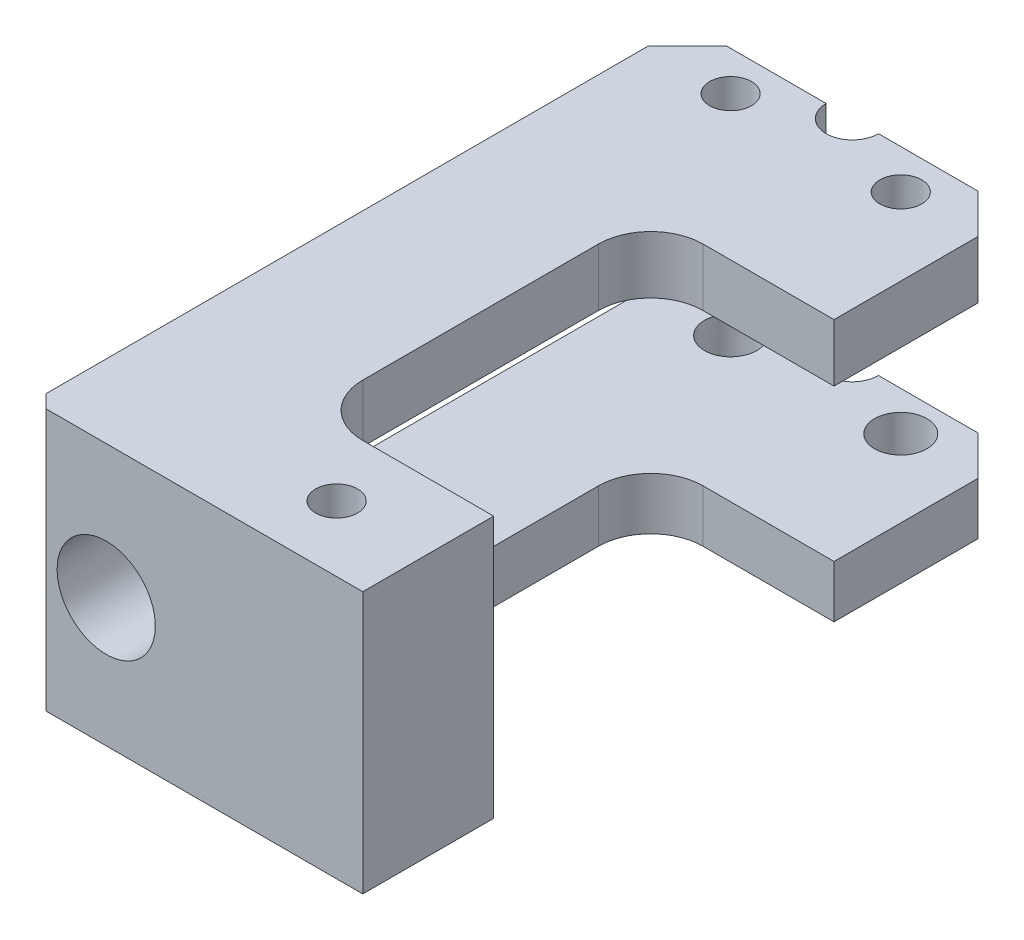
from build123d import *

# Parameters (mm, degrees)
SKETCH1_W                   = 12.6
SKETCH1_H                   = 25
BOSS_EXTRUDE1_DEPTH         = 10
CHAMFER4_SIZE               = 1.5
CUT_EXTRUDE9_START          = -5
SKETCH14_W                  = 7
SKETCH14_H                  = 5.8
CUT_EXTRUDE9_DEPTH          = 20
SKETCH15_W                  = 20
SKETCH15_H                  = 5.8
CUT_EXTRUDE10_DEPTH         = 18.47140521
CUT_EXTRUDE11_DEPTH         = 17.122654868
CUT_EXTRUDE11_DEPTH_BACK    = 17.122654868
SKETCH17_W                  = 7
SKETCH17_H                  = 13
SKETCH18_R                  = 1.875
CUT_EXTRUDE12_DEPTH         = 24.231228982
FILLET2_R                   = 2
SKETCH20_R                  = 1
CUT_EXTRUDE18_DEPTH         = 5
TAP_DRILL_FOR_M2X0_4_TAP2_D = 1.6
TAP_DRILL_FOR_M2X0_4_TAP3_D = 1.6
FILLET4_R                   = 0.2
CHAMFER1_SIZE               = 0.5
SKETCH26_R                  = 1.5
CUT_EXTRUDE20_DEPTH         = 1
SKETCH28_R                  = 1
CUT_EXTRUDE22_DEPTH         = 18.202906826


with BuildPart() as part:
    # Sketch1 → Boss-Extrude1 (new body)
    with BuildSketch(Plane(origin=(0, 0, 0), x_dir=(1, 0, 0), z_dir=(0, 1, 0))):
        Rectangle(SKETCH1_W, SKETCH1_H)
    extrude(amount=BOSS_EXTRUDE1_DEPTH)

    # Chamfer4
    chamfer4_edges = [part.edges().sort_by_distance(p)[0] for p in [
        (6.3, 5, -12.5),
        (-6.3, 5, -12.5),
    ]]
    chamfer(chamfer4_edges, length=CHAMFER4_SIZE)

    # Sketch14 → Cut-Extrude9 (cut)
    with BuildSketch(Plane.XY.offset(12.5).offset(CUT_EXTRUDE9_START)):
        with Locations((2.8, 4.9)):
            Rectangle(SKETCH14_W, SKETCH14_H)
    extrude(amount=-CUT_EXTRUDE9_DEPTH, mode=Mode.SUBTRACT)

    # Sketch15 → Cut-Extrude10 (cut, through all)
    with BuildSketch(Plane(origin=(-0.7, 0, 0), x_dir=(0, 0, -1), z_dir=(1, 0, 0))):
        with Locations((2.5, 4.9)):
            Rectangle(SKETCH15_W, SKETCH15_H)
    extrude(amount=-CUT_EXTRUDE10_DEPTH, mode=Mode.SUBTRACT)

    # Sketch17 → Cut-Extrude11 (cut, two sides: drawn at the far end of the back side and taken through both)
    with BuildSketch(Plane(origin=(0, 2, 0), x_dir=(1, 0, 0), z_dir=(0, 1, 0)).offset(-CUT_EXTRUDE11_DEPTH_BACK)):
        with Locations((2.8, -1)):
            Rectangle(SKETCH17_W, SKETCH17_H)
    extrude(amount=CUT_EXTRUDE11_DEPTH + CUT_EXTRUDE11_DEPTH_BACK, mode=Mode.SUBTRACT)

    # Sketch18 → Cut-Extrude12 (cut, through all)
    with BuildSketch(Plane(origin=(0, 0, 7.5), x_dir=(-1, 0, 0), z_dir=(0, 0, -1))):
        with Locations((3.5, 4.9)):
            Circle(SKETCH18_R)
    extrude(amount=-CUT_EXTRUDE12_DEPTH, mode=Mode.SUBTRACT)

    # Fillet2
    fillet2_edges = [part.edges().sort_by_distance(p)[0] for p in [
        (-0.7, 8.9, -5.5),
        (-0.7, 1, -5.5),
        (-0.7, 1, 7.5),
        (-0.7, 8.9, 7.5),
    ]]
    fillet(fillet2_edges, radius=FILLET2_R)

    # Sketch20 → Cut-Extrude18 (cut)
    with BuildSketch(Plane.XZ):
        with Locations((3.35, -11)):
            Circle(SKETCH20_R)
        with Locations((-3.15, -11)):
            Circle(SKETCH20_R)
    extrude(amount=-CUT_EXTRUDE18_DEPTH, mode=Mode.SUBTRACT)

    # Tap Drill for M2x0.4 Tap2 (through all)
    with Locations(Plane(origin=(3.35, 10, -11), x_dir=(0, 0, 1), z_dir=(0, 1, 0))):
        with Locations((0, 0), (0, -6.5)):
            Hole(TAP_DRILL_FOR_M2X0_4_TAP2_D / 2)

    # Tap Drill for M2x0.4 Tap3 (through all)
    with Locations(Plane(origin=(2.8, 10, 10), x_dir=(0, 0, 1), z_dir=(0, 1, 0))):
        with Locations((0, 0)):
            Hole(TAP_DRILL_FOR_M2X0_4_TAP3_D / 2)

    # Fillet4
    fillet4_edges = [part.edges().sort_by_distance(p)[0] for p in [
        (-2.5, 7.8, 7.5),
        (-2.5, 2, 7.5),
    ]]
    fillet(fillet4_edges, radius=FILLET4_R)

    # Chamfer1
    chamfer1_edges = [part.edges().sort_by_distance(p)[0] for p in [
        (-6.3, 5, 12.5),
    ]]
    chamfer(chamfer1_edges, length=CHAMFER1_SIZE)

    # Sketch26 → Cut-Extrude20 (cut)
    with BuildSketch(Plane.XZ):
        with Locations((2.8, 10)):
            Circle(SKETCH26_R)
    extrude(amount=-CUT_EXTRUDE20_DEPTH, mode=Mode.SUBTRACT)

    # Sketch28 → Cut-Extrude22 (cut, through all)
    with BuildSketch(Plane(origin=(0, 0, 0), x_dir=(-1, 0, 0), z_dir=(0, -1, 0))):
        with Locations((0, 12.5)):
            Circle(SKETCH28_R)
    extrude(amount=-CUT_EXTRUDE22_DEPTH, mode=Mode.SUBTRACT)


solid = part.part
